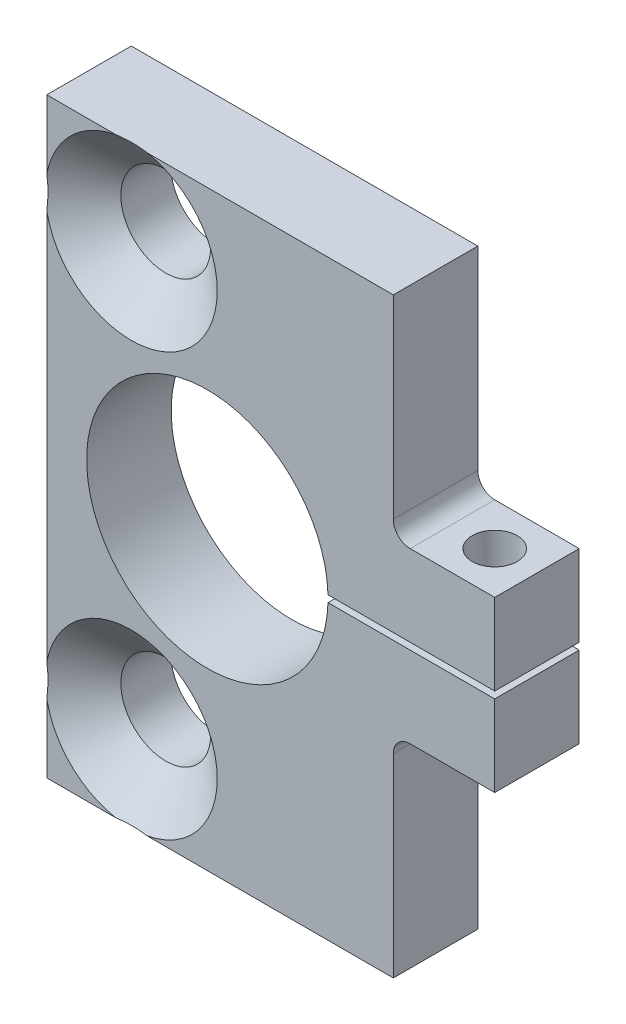
from build123d import *

# Parameters (mm, degrees)
SKETCH1_W                                           = 67.31
SKETCH1_H                                           = 88.9
EXTRUDE1_DEPTH                                      = 12.7
SKETCH2_R                                           = 18.1356
EXTRUDE2_DEPTH                                      = 58.181741185
SKETCH3_W                                           = 28.468633454
SKETCH3_H                                           = 1.016
EXTRUDE3_DEPTH                                      = 58.181741185
F_1_4_CLEARANCE_HOLE1_D                             = 6.7564
CSK_FOR_1_2_FLAT_HEAD_MACHINE_SCREW_100_D           = 13.49248
CSK_FOR_1_2_FLAT_HEAD_MACHINE_SCREW_100_CSINK_D     = 25.8318
CSK_FOR_1_2_FLAT_HEAD_MACHINE_SCREW_100_CSINK_ANGLE = 100
SKETCH10_W                                          = 15.24
SKETCH10_H                                          = 31.75
EXTRUDE4_DEPTH                                      = 58.181741185
FILLET1_R                                           = 2.54
FILLET1_OF_MIRROR2_R                                = 2.54


with BuildPart() as part:
    # Sketch1 → Extrude1 (new body)
    with BuildSketch(Plane.XY):
        Rectangle(SKETCH1_W, SKETCH1_H)
    extrude(amount=EXTRUDE1_DEPTH)

    # Sketch2 → Extrude2 (cut, through all)
    with BuildSketch(Plane.XY.offset(12.7)):
        with Locations((-9.525, 0)):
            Circle(SKETCH2_R)
    extrude(amount=-EXTRUDE2_DEPTH, mode=Mode.SUBTRACT)

    # Sketch3 → Extrude3 (cut, through all)
    with BuildSketch(Plane.XY.offset(12.7)):
        with Locations((21.1328, 0)):
            Rectangle(SKETCH3_W, SKETCH3_H)
    extrude(amount=-EXTRUDE3_DEPTH, mode=Mode.SUBTRACT)

    # 1/4 Clearance Hole1 (through all)
    with Locations(Plane(origin=(27.305, 44.45, 6.35), x_dir=(0, 0, 1), z_dir=(0, 1, 0))):
        with Locations((0, 0)):
            Hole(F_1_4_CLEARANCE_HOLE1_D / 2)

    # CSK for 1/2 Flat Head Machine Screw (100)1 (through all)
    with Locations(Plane(origin=(-20.955, 31.75, 12.7), x_dir=(1, 0, 0), z_dir=(0, 0, 1))):
        with Locations((0, 0)):
            csk_for_1_2_flat_head_machine_screw_100 = CounterSinkHole(CSK_FOR_1_2_FLAT_HEAD_MACHINE_SCREW_100_D / 2, CSK_FOR_1_2_FLAT_HEAD_MACHINE_SCREW_100_CSINK_D / 2, counter_sink_angle=CSK_FOR_1_2_FLAT_HEAD_MACHINE_SCREW_100_CSINK_ANGLE)

    # Mirror1: CSK for 1/2 Flat Head Machine Screw (100)1 across plane
    add(csk_for_1_2_flat_head_machine_screw_100.mirror(Plane.ZX), mode=Mode.SUBTRACT)

    # Sketch10 → Extrude4 (cut, through all)
    with BuildSketch(Plane.XY.offset(12.7)):
        with Locations((26.035, 28.575)):
            Rectangle(SKETCH10_W, SKETCH10_H)
    extrude4 = extrude(amount=-EXTRUDE4_DEPTH, mode=Mode.SUBTRACT)

    # Fillet1
    fillet1_edges = [part.edges().sort_by_distance(p)[0] for p in [
        (18.415, 12.7, 6.35),
    ]]
    fillet(fillet1_edges, radius=FILLET1_R)

    # Mirror2: Extrude4 across plane
    add(extrude4.mirror(Plane.ZX), mode=Mode.SUBTRACT)

    # Fillet1 of Mirror2
    fillet1_of_mirror2_edges = [part.edges().sort_by_distance(p)[0] for p in [
        (18.415, -12.7, 6.35),
    ]]
    fillet(fillet1_of_mirror2_edges, radius=FILLET1_OF_MIRROR2_R)


solid = part.part
